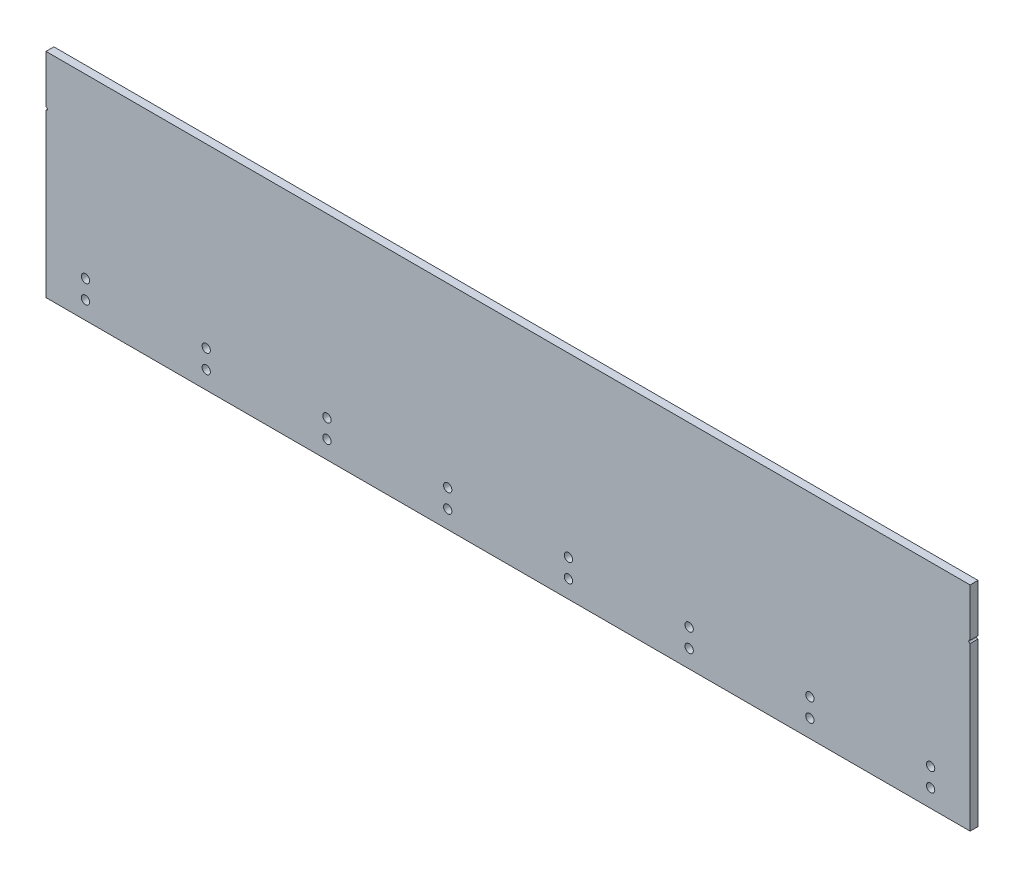
from build123d import *

# Parameters (mm, degrees)
IZIM1_R            = 10.5
TABAN_FLAN_1_DEPTH = 20


# Sheet-metal steps are written as plain solids
with BuildPart() as part:
    # Çizim1 → Taban-Flanş1 (new body)
    with BuildSketch(Plane.XY):
        with BuildLine():
            Line((0, 0), (2340, 0))
            Line((2340, 0), (2340, 411.5))
            ThreePointArc((2340, 411.5), (2336.5, 415), (2340, 418.5))
            Line((2340, 418.5), (2340, 540))
            Line((2340, 540), (0, 540))
            Line((0, 540), (0, 418.5))
            ThreePointArc((0, 418.5), (3.5, 415), (0, 411.5))
            Line((0, 411.5), (0, 0))
        make_face()
        with Locations((100, 92)):
            Circle(IZIM1_R, mode=Mode.SUBTRACT)
        with Locations((100, 45)):
            Circle(IZIM1_R, mode=Mode.SUBTRACT)
        with Locations((405.714285714, 92)):
            Circle(IZIM1_R, mode=Mode.SUBTRACT)
        with Locations((405.714285714, 45)):
            Circle(IZIM1_R, mode=Mode.SUBTRACT)
        with Locations((711.428571429, 92)):
            Circle(IZIM1_R, mode=Mode.SUBTRACT)
        with Locations((711.428571429, 45)):
            Circle(IZIM1_R, mode=Mode.SUBTRACT)
        with Locations((1017.142857143, 92)):
            Circle(IZIM1_R, mode=Mode.SUBTRACT)
        with Locations((1017.142857143, 45)):
            Circle(IZIM1_R, mode=Mode.SUBTRACT)
        with Locations((1322.857142857, 92)):
            Circle(IZIM1_R, mode=Mode.SUBTRACT)
        with Locations((1322.857142857, 45)):
            Circle(IZIM1_R, mode=Mode.SUBTRACT)
        with Locations((1628.571428571, 92)):
            Circle(IZIM1_R, mode=Mode.SUBTRACT)
        with Locations((1628.571428571, 45)):
            Circle(IZIM1_R, mode=Mode.SUBTRACT)
        with Locations((1934.285714286, 92)):
            Circle(IZIM1_R, mode=Mode.SUBTRACT)
        with Locations((1934.285714286, 45)):
            Circle(IZIM1_R, mode=Mode.SUBTRACT)
        with Locations((2240, 92)):
            Circle(IZIM1_R, mode=Mode.SUBTRACT)
        with Locations((2240, 45)):
            Circle(IZIM1_R, mode=Mode.SUBTRACT)
    extrude(amount=-TABAN_FLAN_1_DEPTH)


solid = part.part
